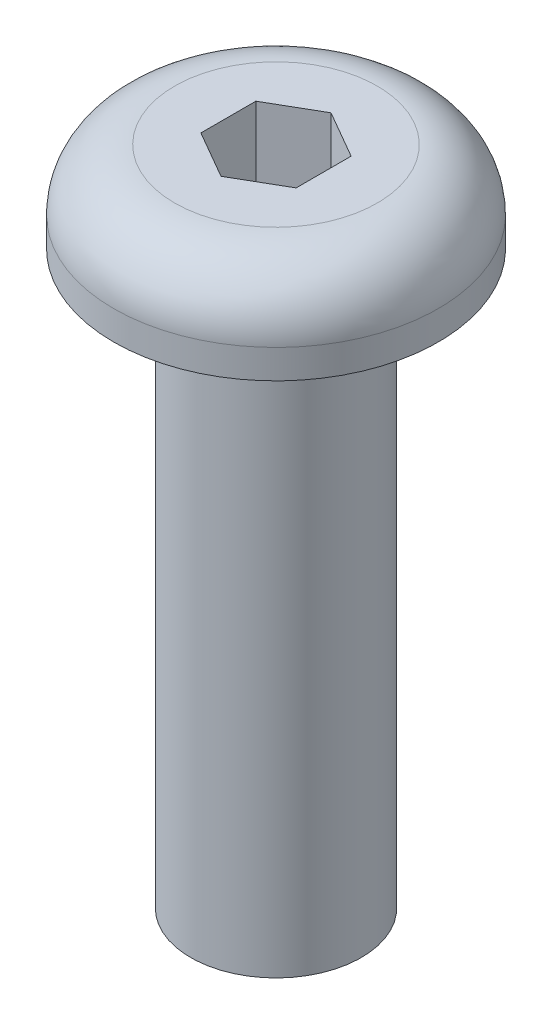
from build123d import *

# Parameters (mm, degrees)
SKETCH1_R           = 1.4224
BOSS_EXTRUDE1_DEPTH = 9.525
SKETCH2_R           = 2.7051
BOSS_EXTRUDE2_DEPTH = 1.4986
FILLET1_R           = 1.016
CUT_EXTRUDE1_DEPTH  = 2.38125


with BuildPart() as part:
    # Sketch1 → Boss-Extrude1 (new body)
    with BuildSketch(Plane(origin=(0, 0, 0), x_dir=(1, 0, 0), z_dir=(0, 1, 0))):
        Circle(SKETCH1_R)
    extrude(amount=BOSS_EXTRUDE1_DEPTH)

    # Sketch2 → Boss-Extrude2 (add)
    with BuildSketch(Plane(origin=(0, 9.525, 0), x_dir=(1, 0, 0), z_dir=(0, 1, 0))):
        Circle(SKETCH2_R)
    extrude(amount=BOSS_EXTRUDE2_DEPTH)

    # Fillet1
    fillet1_edges = [part.edges().sort_by_distance(p)[0] for p in [
        (-2.7051, 11.0236, 0),
    ]]
    fillet(fillet1_edges, radius=FILLET1_R)

    # Sketch3 → Cut-Extrude1 (cut)
    with BuildSketch(Plane(origin=(0, 11.0236, 0), x_dir=(1, 0, 0), z_dir=(0, 1, 0))):
        Polygon((0, 0.916543552), (-0.79375, 0.458271776), (-0.79375, -0.458271776), (0, -0.916543552), (0.79375, -0.458271776), (0.79375, 0.458271776), align=None)
    extrude(amount=-CUT_EXTRUDE1_DEPTH, mode=Mode.SUBTRACT)


solid = part.part
